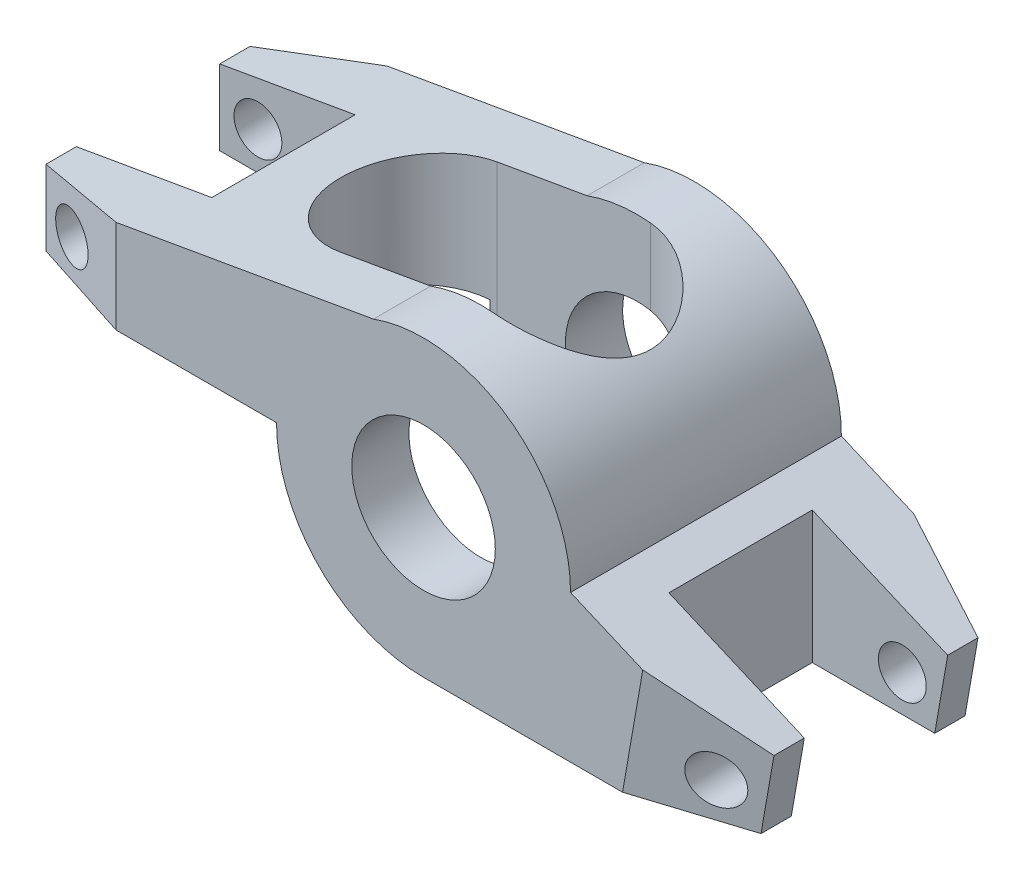
from build123d import *

# Parameters (mm, degrees)
SKETCH1_R               = 4.77
SKETCH1_R_2             = 1.59
BOSS_EXTRUDE1_DEPTH     = 18
CHAMFER1_SIZE           = 2.22
CHAMFER1_SIZE_2         = 6.88
CHAMFER2_SIZE           = 6.88
CHAMFER2_SIZE_2         = 2.22
CUT_EXTRUDE1_DEPTH      = 35.136329621
CUT_EXTRUDE1_DEPTH_BACK = 35.136329621
SKETCH3_W               = 9
SKETCH3_H               = 9.53


with BuildPart() as part:
    # Sketch1 → Boss-Extrude1 (new body)
    with BuildSketch(Plane.XY):
        with BuildLine():
            Line((-27.31, 0), (-27.31, 5))
            Line((-27.31, 5), (-3.328977305, 9.185358464))
            ThreePointArc((-3.328977305, 9.185358464), (5.609313315, 7.999281476), (9.77, 0))
            Line((9.77, 0), (21.07, -4.844453369))
            Line((21.07, -4.844453369), (20.210354499, -9.77))
            Line((20.210354499, -9.77), (0, -9.77))
            ThreePointArc((0, -9.77), (-6.908433252, -6.908433252), (-9.77, 0))
            Line((-9.77, 0), (-27.31, 0))
        make_face()
        Circle(SKETCH1_R, mode=Mode.SUBTRACT)
        with Locations((-24.77, 2.5)):
            Circle(SKETCH1_R_2, mode=Mode.SUBTRACT)
        with Locations((18.055286128, -7.344453369)):
            Circle(SKETCH1_R_2, mode=Mode.SUBTRACT)
    extrude(amount=BOSS_EXTRUDE1_DEPTH)

    # Chamfer1
    # the kernel refuses this chamfer: 6.88, 2.22 mm, written as the material it takes off along each edge
    with BuildSketch(Plane(origin=(-27.31, -17.856007533, 18), x_dir=(-0.11292116623223689, 0, -0.9936039503830244), z_dir=(0, 1, 0))) as chamfer1_piece_1:
        Polygon((CHAMFER1_SIZE * 0.993603950383, -CHAMFER1_SIZE * 0.112921166232), (-CHAMFER1_SIZE_2 * 0.112921166232, -CHAMFER1_SIZE_2 * 0.993603950383), (0, 0), align=None)
    extrude(amount=40.712015065, mode=Mode.SUBTRACT)
    with BuildSketch(Plane(origin=(-27.31, -17.856007533, 0), x_dir=(-0.1129211662322369, 0, 0.9936039503830242), z_dir=(0, 1, 0))) as chamfer1_piece_2:
        Polygon((CHAMFER1_SIZE * 0.993603950383, CHAMFER1_SIZE * 0.112921166232), (-CHAMFER1_SIZE_2 * 0.112921166232, CHAMFER1_SIZE_2 * 0.993603950383), (0, 0), align=None)
    extrude(amount=40.712015065, mode=Mode.SUBTRACT)

    # Chamfer2
    # the kernel refuses this chamfer: 6.88, 2.22 mm, written as the material it takes off along each edge
    with BuildSketch(Plane(origin=(24.13996731, 12.745666179, 0), x_dir=(-0.9850403671370294, 0.1719170650041742, -0.011832069594835619), z_dir=(-0.17192910027940936, -0.985109326154774, 0))) as chamfer2_piece_1:
        Polygon((CHAMFER2_SIZE * 0.999929998614, -CHAMFER2_SIZE * 0.0118320695948), (-CHAMFER2_SIZE_2 * 0.0118320695948, -CHAMFER2_SIZE_2 * 0.999929998614), (0, 0), align=None)
    extrude(amount=40.712015065, mode=Mode.SUBTRACT)
    with BuildSketch(Plane(origin=(24.13996731, 12.745666179, 18), x_dir=(-0.9850403671370294, 0.1719170650041742, 0.011832069594835435), z_dir=(-0.17192910027940936, -0.985109326154774, 0))) as chamfer2_piece_2:
        Polygon((CHAMFER2_SIZE * 0.999929998614, CHAMFER2_SIZE * 0.0118320695948), (-CHAMFER2_SIZE_2 * 0.0118320695948, CHAMFER2_SIZE_2 * 0.999929998614), (0, 0), align=None)
    extrude(amount=40.712015065, mode=Mode.SUBTRACT)

    # Sketch3 → Cut-Extrude1 (cut, two sides: drawn at the far end of the back side and taken through both)
    with BuildSketch(Plane(origin=(0, 0, 0), x_dir=(1, 0, 0), z_dir=(0, 1, 0)).offset(-CUT_EXTRUDE1_DEPTH_BACK)):
        with Locations((-22.81, -9)):
            Rectangle(SKETCH3_W, SKETCH3_H)
        with BuildLine():
            Line((-9.31, -3.8), (0.89, -3.8))
            ThreePointArc((0.89, -3.8), (6.09, -9), (0.89, -14.2))
            Line((0.89, -14.2), (-9.31, -14.2))
            ThreePointArc((-9.31, -14.2), (-14.51, -9), (-9.31, -3.8))
        make_face()
        with Locations((16.57, -9)):
            Rectangle(SKETCH3_W, SKETCH3_H)
    extrude(amount=CUT_EXTRUDE1_DEPTH + CUT_EXTRUDE1_DEPTH_BACK, mode=Mode.SUBTRACT)


solid = part.part
